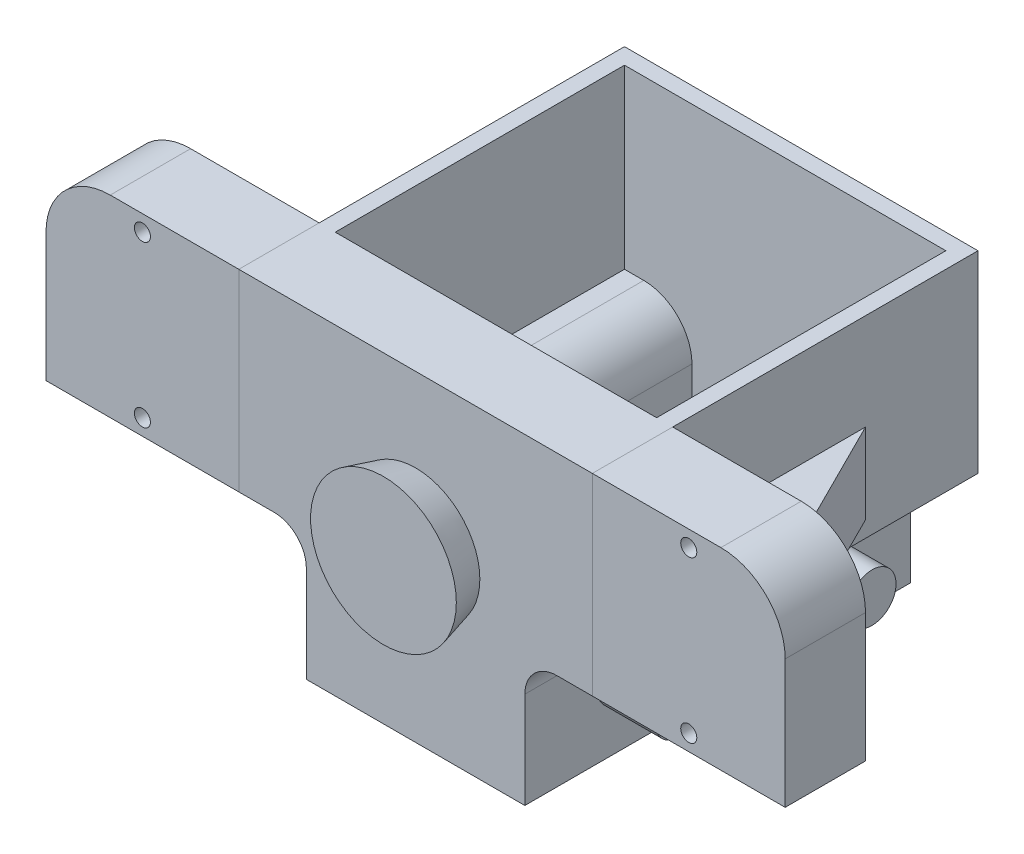
from build123d import *

# Parameters (mm, degrees)
SKETCH1_W           = 279.4
SKETCH1_H           = 304.8
BOSS_EXTRUDE1_DEPTH = 254
CUT_EXTRUDE2_REACH  = 422.637
SKETCH6_R           = 19.05
BOSS_EXTRUDE4_DEPTH = 45.72
SHELL3_T            = -12.7
SKETCH2_R           = 50.8
BOSS_EXTRUDE2_DEPTH = 25.4
BOSS_EXTRUDE2_DRAFT = -15
BOSS_EXTRUDE6_REACH = 342.066
SKETCH11_W          = 279.4
SKETCH11_H          = 63.5
BOSS_EXTRUDE7_DEPTH = 63.5
GUSSET1_START       = 114.3
GUSSET1_DEPTH       = 63.5
SKETCH16_R          = 6.35
CUT_EXTRUDE4_DEPTH  = 38.1
SKETCH17_R          = 6.35
CUT_EXTRUDE5_DEPTH  = 38.1


# Read off the part's stored shape, not the designer's step: Gusset1
with BuildPart() as part:
    # Sketch1 → Boss-Extrude1 (new body)
    with BuildSketch(Plane(origin=(0, 0, 0), x_dir=(1, 0, 0), z_dir=(0, 1, 0))):
        Rectangle(SKETCH1_W, SKETCH1_H)
    extrude(amount=BOSS_EXTRUDE1_DEPTH)

    # Sketch5 → Cut-Extrude2 (cut, up to next)
    with BuildSketch(Plane.XY.offset(152.4), mode=Mode.PRIVATE) as cut_extrude2_sk1:
        with BuildLine():
            Line((86.36, 0), (86.36, 76.2))
            ThreePointArc((86.36, 76.2), (93.799487758, 94.160512242), (111.76, 101.6))
            Line((111.76, 101.6), (139.7, 101.6))
            Line((139.7, 101.6), (139.7, 0))
            Line((139.7, 0), (86.36, 0))
        make_face()
    cut_extrude2_tool1 = extrude(cut_extrude2_sk1.sketch, amount=-CUT_EXTRUDE2_REACH, mode=Mode.PRIVATE) & part.part
    cut_extrude2 = cut_extrude2_tool1.solids().sort_by_distance((113.580478, 49.616891, 152.4))[0]
    add(cut_extrude2, mode=Mode.SUBTRACT)

    # Mirror17: Cut-Extrude2 across plane
    add(cut_extrude2.mirror(Plane(origin=(0, 0, 0), x_dir=(0, 0, 1), z_dir=(1, 0, 0))), mode=Mode.SUBTRACT)

    # Sketch6 → Boss-Extrude4 (add)
    with BuildSketch(Plane(origin=(86.36, 0, 0), x_dir=(0, 0, -1), z_dir=(1, 0, 0))):
        with Locations(Location((-76.2, 50.8, 0), (0, 0, 180))):
            Circle(SKETCH6_R)
        with Locations(Location((76.2, 50.8, 0), (0, 0, 180))):
            Circle(SKETCH6_R)
    boss_extrude4 = extrude(amount=BOSS_EXTRUDE4_DEPTH)

    # Mirror18: Boss-Extrude4 across plane
    add(boss_extrude4.mirror(Plane(origin=(0, 0, 0), x_dir=(0, 0, 1), z_dir=(1, 0, 0))))

    # Shell3
    shell3_openings = [part.faces().sort_by_distance(p)[0] for p in [
        (0, 254, 0),
    ]]
    offset(amount=SHELL3_T, openings=shell3_openings, kind=Kind.INTERSECTION)


with BuildPart() as boss_extrude2_tool:
    # Sketch2 → Boss-Extrude2 (with draft: the straight prism first)
    with BuildSketch(Plane.XY.offset(152.4)):
        with Locations((0, 137.16)):
            Circle(SKETCH2_R)
    extrude(amount=BOSS_EXTRUDE2_DEPTH)
    # Boss-Extrude2: the draft: its side faces are tilted about the plane it starts from
    boss_extrude2_sides = [boss_extrude2_tool.faces().sort_by_distance(p)[0] for p in [
        (-50.8, 137.16, 165.1),
    ]]
    draft(boss_extrude2_sides, Plane.XY.offset(152.4), BOSS_EXTRUDE2_DRAFT)


with BuildPart() as part_1:
    add(part.part)

    # Boss-Extrude2: add boss_extrude2_tool
    add(boss_extrude2_tool.part)

    # Sketch11 → Boss-Extrude6 (add, up to next)
    with BuildSketch(Plane(origin=(0, 254, 0), x_dir=(1, 0, 0), z_dir=(0, 1, 0)), mode=Mode.PRIVATE) as boss_extrude6_sk1:
        with Locations((0, -120.65)):
            Rectangle(SKETCH11_W, SKETCH11_H)
    boss_extrude6_tool1 = extrude(boss_extrude6_sk1.sketch, amount=-BOSS_EXTRUDE6_REACH, mode=Mode.PRIVATE) - part_1.part
    add(boss_extrude6_tool1.solids().sort_by_distance((0, 254, 120.65))[0])


with BuildPart() as body_2:
    # Sketch12 → Boss-Extrude7 (new body)
    with BuildSketch(Plane.XY.offset(152.4)):
        with BuildLine():
            Line((139.7, 254), (139.7, 101.6))
            Line((139.7, 101.6), (292.1, 101.6))
            Line((292.1, 101.6), (292.1, 203.2))
            ThreePointArc((292.1, 203.2), (277.221024484, 239.121024484), (241.3, 254))
            Line((241.3, 254), (139.7, 254))
        make_face()
    extrude(amount=-BOSS_EXTRUDE7_DEPTH)


with BuildPart() as body_3:
    # Mirror7: mirrored copy
    add(body_2.part.mirror(Plane(origin=(0, 0, 0), x_dir=(0, 0, 1), z_dir=(1, 0, 0))))

    # Sketch17 → Cut-Extrude5 (cut)
    with BuildSketch(Plane.XY.offset(152.4)):
        with Locations((-215.9, 241.3)):
            Circle(SKETCH17_R)
        with Locations((-215.9, 114.3)):
            Circle(SKETCH17_R)
    extrude(amount=-CUT_EXTRUDE5_DEPTH, mode=Mode.SUBTRACT)


with BuildPart() as body_4:
    # Gusset1 outline → Gusset1 (new body)
    with BuildSketch(Plane(origin=(0, 0, 0), x_dir=(1, 0, 0), z_dir=(0, 1, 0)).offset(GUSSET1_START)):
        Polygon((215.9, -88.9), (139.7, 63.5), (139.7, -88.9), align=None)
    extrude(amount=GUSSET1_DEPTH)


with BuildPart() as body_2_1:
    add(body_2.part)

    # Sketch16 → Cut-Extrude4 (cut)
    with BuildSketch(Plane.XY.offset(152.4)):
        with Locations((215.9, 114.3)):
            Circle(SKETCH16_R)
        with Locations((215.9, 241.3)):
            Circle(SKETCH16_R)
    extrude(amount=-CUT_EXTRUDE4_DEPTH, mode=Mode.SUBTRACT)


with BuildPart() as body_5:
    # Mirror13: mirrored copy
    add(body_4.part.mirror(Plane(origin=(0, 0, 0), x_dir=(0, 0, 1), z_dir=(1, 0, 0))))


solid = Compound([part_1.part, body_3.part, body_4.part, body_2_1.part, body_5.part])
